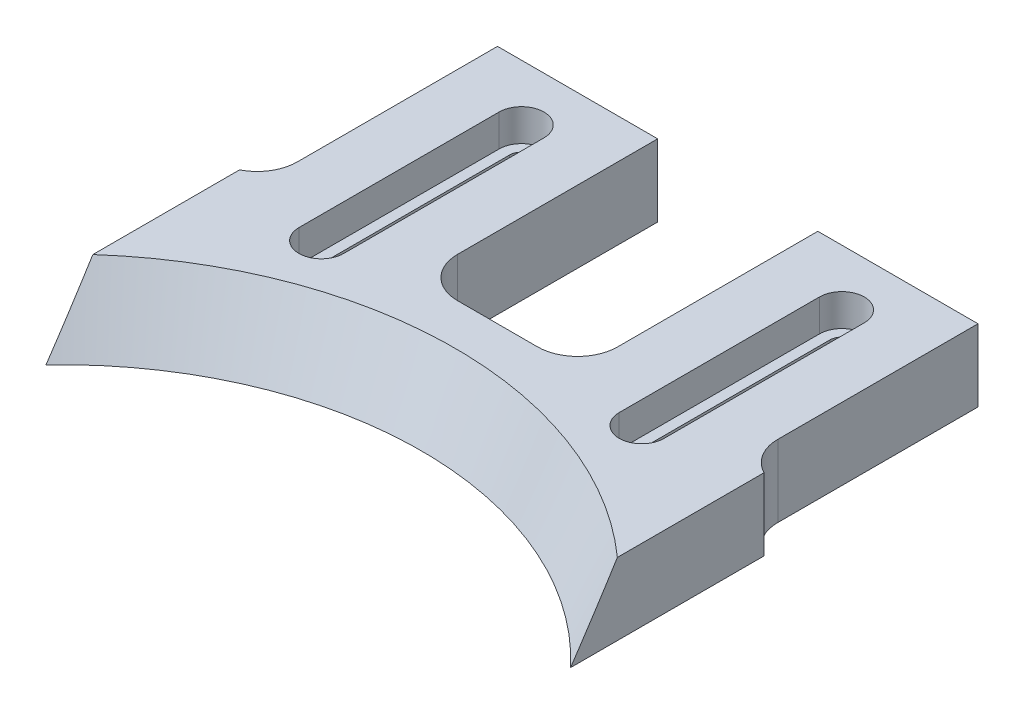
from build123d import *

# Parameters (mm, degrees)
BOSS_EXTRUDE1_DEPTH = 9
CUT_EXTRUDE2_REACH  = 98.857
SKETCH5_W           = 20
SKETCH5_H           = 30
SKETCH5_W_2         = 7.75
CUT_EXTRUDE3_DEPTH  = 10
FILLET1_R           = 5
CUT_EXTRUDE4_DEPTH  = 4
CHAMFER1_SIZE       = 9
CHAMFER1_SIZE_2     = 4.196768923
CUT_EXTRUDE5_REACH  = 98.857
SKETCH7_W           = 5
SKETCH7_H           = 33.085129134
SKETCH7_H_2         = 33.745309592


with BuildPart() as part:
    # Sketch1 → Boss-Extrude1 (new body)
    with BuildSketch(Plane(origin=(0, 0, 0), x_dir=(1, 0, 0), z_dir=(0, 1, 0))):
        with BuildLine():
            Line((0, 0), (0, 60))
            Line((0, 60), (75.5, 60))
            Line((75.5, 60), (75.5, 0))
            ThreePointArc((75.5, 0), (37.75, 20.506378381), (0, 0))
        make_face()
    extrude(amount=BOSS_EXTRUDE1_DEPTH)

    # Sketch4 → Cut-Extrude2 (cut, up to next)
    with BuildSketch(Plane(origin=(0, 9, 0), x_dir=(1, 0, 0), z_dir=(0, 1, 0)), mode=Mode.PRIVATE) as cut_extrude2_sk1:
        with BuildLine():
            Line((19.25, 53), (19.25, 28))
            ThreePointArc((19.25, 28), (17.75, 26.5), (16.25, 28))
            Line((16.25, 28), (16.25, 53))
            ThreePointArc((16.25, 53), (17.75, 54.5), (19.25, 53))
        make_face()
    cut_extrude2_tool1 = extrude(cut_extrude2_sk1.sketch, amount=-CUT_EXTRUDE2_REACH, mode=Mode.PRIVATE) & part.part
    # Sketch4 → Cut-Extrude2 (cut, up to next)
    with BuildSketch(Plane(origin=(0, 9, 0), x_dir=(1, 0, 0), z_dir=(0, 1, 0)), mode=Mode.PRIVATE) as cut_extrude2_sk2:
        with BuildLine():
            Line((59.25, 53), (59.25, 28))
            ThreePointArc((59.25, 28), (57.75, 26.5), (56.25, 28))
            Line((56.25, 28), (56.25, 53))
            ThreePointArc((56.25, 53), (57.75, 54.5), (59.25, 53))
        make_face()
    cut_extrude2_tool2 = extrude(cut_extrude2_sk2.sketch, amount=-CUT_EXTRUDE2_REACH, mode=Mode.PRIVATE) & part.part
    add(cut_extrude2_tool1.solids().sort_by_distance((17.75, 9, -40.5))[0], mode=Mode.SUBTRACT)
    add(cut_extrude2_tool2.solids().sort_by_distance((57.75, 9, -40.5))[0], mode=Mode.SUBTRACT)

    # Sketch5 → Cut-Extrude3 (cut)
    with BuildSketch(Plane(origin=(0, 9, 0), x_dir=(1, 0, 0), z_dir=(0, 1, 0))):
        with Locations((37.75, 45)):
            Rectangle(SKETCH5_W, SKETCH5_H)
        with Locations((71.625, 45)):
            Rectangle(SKETCH5_W_2, SKETCH5_H)
        with Locations((3.875, 45)):
            Rectangle(SKETCH5_W_2, SKETCH5_H)
    extrude(amount=-CUT_EXTRUDE3_DEPTH, mode=Mode.SUBTRACT)

    # Fillet1
    fillet1_edges = [part.edges().sort_by_distance(p)[0] for p in [
        (27.75, 4.5, -30),
        (47.75, 4.5, -30),
        (7.75, 4.5, -30),
        (67.75, 4.5, -30),
    ]]
    fillet(fillet1_edges, radius=FILLET1_R)

    # Sketch6 → Cut-Extrude4 (cut)
    with BuildSketch(Plane(origin=(0, 9, 0), x_dir=(1, 0, 0), z_dir=(0, 1, 0))):
        with BuildLine():
            Line((20.55, 53), (20.55, 28))
            ThreePointArc((20.55, 28), (17.75, 25.2), (14.95, 28))
            Line((14.95, 28), (14.95, 53))
            ThreePointArc((14.95, 53), (17.75, 55.8), (20.55, 53))
        make_face()
        with BuildLine():
            Line((60.55, 53), (60.55, 28))
            ThreePointArc((60.55, 28), (57.75, 25.2), (54.95, 28))
            Line((54.95, 28), (54.95, 53))
            ThreePointArc((54.95, 53), (57.75, 55.8), (60.55, 53))
        make_face()
    extrude(amount=-CUT_EXTRUDE4_DEPTH, mode=Mode.SUBTRACT)

    # Chamfer1
    # the kernel refuses this chamfer: 9, 4.196768923 mm, written as the material it takes off along each edge
    with BuildSketch(Plane(origin=(37.75, 9, 24.493621619), x_dir=(0.9983743289729347, 0, -0.05699736176212511), z_dir=(0.05699736176212511, 0, 0.9983743289729347))) as chamfer1_piece_1:
        Polygon((45, -CHAMFER1_SIZE), (45 + CHAMFER1_SIZE_2, 0), (45, 0), align=None)
    revolve(axis=Axis((37.75, 9, 24.493621619), (0, 1, 0)), revolution_arc=173.465041841, mode=Mode.SUBTRACT)

    # Sketch7 → Cut-Extrude5 (cut, up to next)
    with BuildSketch(Plane(origin=(0, 9, 0), x_dir=(1, 0, 0), z_dir=(0, 1, 0)), mode=Mode.PRIVATE) as cut_extrude5_sk1:
        with Locations((2.5, 16.542564567)):
            Rectangle(SKETCH7_W, SKETCH7_H)
    cut_extrude5_tool1 = extrude(cut_extrude5_sk1.sketch, amount=-CUT_EXTRUDE5_REACH, mode=Mode.PRIVATE) & part.part
    # Sketch7 → Cut-Extrude5 (cut, up to next)
    with BuildSketch(Plane(origin=(0, 9, 0), x_dir=(1, 0, 0), z_dir=(0, 1, 0)), mode=Mode.PRIVATE) as cut_extrude5_sk2:
        with Locations((73, 16.872654796)):
            Rectangle(SKETCH7_W, SKETCH7_H_2)
    cut_extrude5_tool2 = extrude(cut_extrude5_sk2.sketch, amount=-CUT_EXTRUDE5_REACH, mode=Mode.PRIVATE) & part.part
    add(cut_extrude5_tool1.solids().sort_by_distance((2.5, 9, -16.542565))[0], mode=Mode.SUBTRACT)
    add(cut_extrude5_tool2.solids().sort_by_distance((73, 9, -16.872655))[0], mode=Mode.SUBTRACT)


solid = part.part
